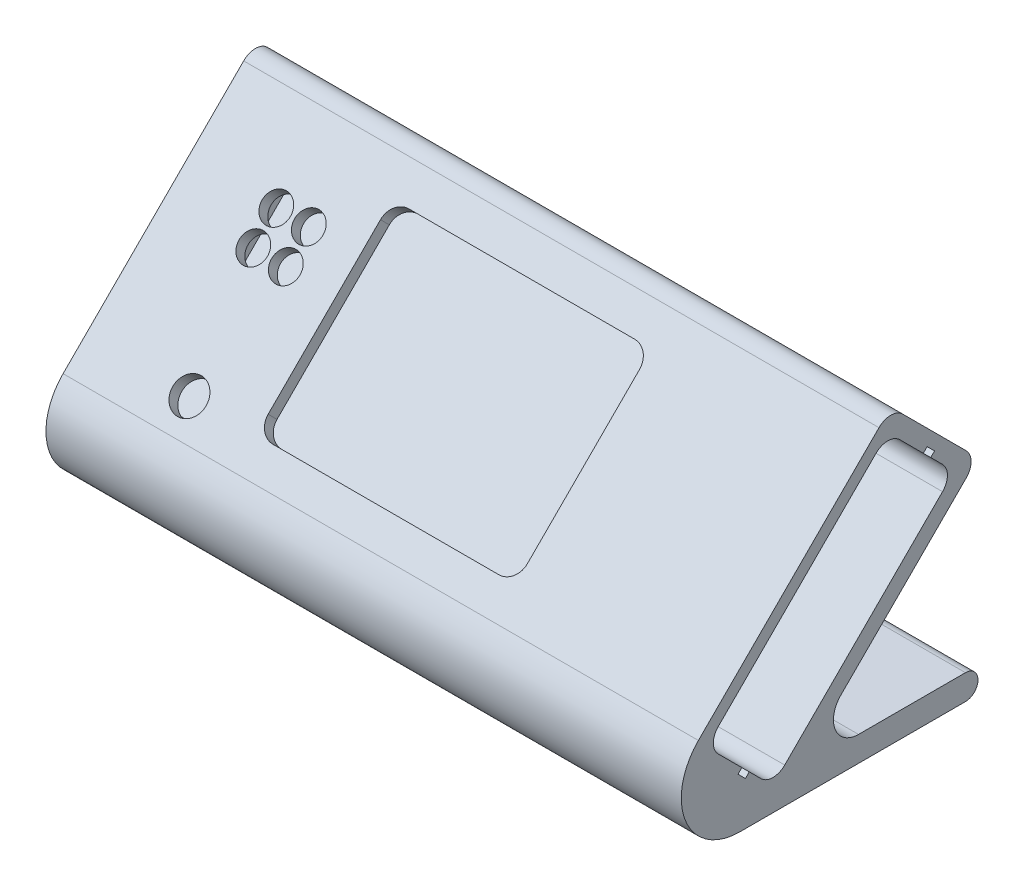
from build123d import *

# Parameters (mm, degrees)
BOSS_EXTRUDE1_DEPTH = 74.5
FILLET1_R           = 7
FILLET2_R           = 2
FILLET3_R           = 1.5
FILLET4_R           = 3
SKETCH3_R           = 2
SKETCH3_R_2         = 1.7
SKETCH3_W           = 31
SKETCH3_H           = 23
CUT_EXTRUDE1_DEPTH  = 1.5
FILLET5_R           = 2
BOSS_EXTRUDE3_DEPTH = 1.5


with BuildPart() as part:
    # Sketch1 → Boss-Extrude1 (new body)
    with BuildSketch(Plane(origin=(0, 0, 0), x_dir=(0, 0, -1), z_dir=(1, 0, 0))):
        Polygon((-20.859650045, -2.828427125), (0, -2.828427125), (24.536605307, -2.828427125), (24.536605307, 0.171572875), (3, 0.171572875), (24.536605307, 21.708178182), (14.106780285, 32.138003205), (-10.429825023, 7.601397898), align=None)
        Polygon((19.339370465, 24.996224715), (18.879751058, 24.536605307), (21.708178182, 21.708178182), (0, 0), (-2.828427125, 2.828427125), (-3.288046533, 2.368807717), (-4.171930009, 3.252691193), (-3.712310601, 3.712310601), (-7.954951288, 7.954951288), (13.753226894, 29.663129471), (17.995867581, 25.420488784), (18.455486989, 25.880108191), align=None, mode=Mode.SUBTRACT)
    extrude(amount=BOSS_EXTRUDE1_DEPTH)

    # Fillet1
    fillet1_edges = [part.edges().sort_by_distance(p)[0] for p in [
        (37.25, -2.828427125, 20.859650045),
    ]]
    fillet(fillet1_edges, radius=FILLET1_R)

    # Fillet2
    fillet2_edges = [part.edges().sort_by_distance(p)[0] for p in [
        (37.25, 32.138003205, -14.106780285),
        (37.25, 21.708178182, -24.536605307),
        (37.25, 29.663129471, -13.753226894),
        (37.25, 7.954951288, 7.954951288),
        (37.25, 0, 0),
        (37.25, 21.708178182, -21.708178182),
    ]]
    fillet(fillet2_edges, radius=FILLET2_R)

    # Fillet3
    fillet3_edges = [part.edges().sort_by_distance(p)[0] for p in [
        (37.25, -2.828427125, -24.536605307),
        (37.25, 0.171572875, -24.536605307),
    ]]
    fillet(fillet3_edges, radius=FILLET3_R - 0.0001)  # a hair under: the kernel refuses the full size

    # Fillet4
    fillet4_edges = [part.edges().sort_by_distance(p)[0] for p in [
        (37.25, 0.171572875, -3),
    ]]
    fillet(fillet4_edges, radius=FILLET4_R)

    # Sketch3 → Cut-Extrude1 (cut)
    with BuildSketch(Plane(origin=(0, 9.01561146, 9.01561146), x_dir=(1, 0, 0), z_dir=(0, 0.7071067811865475, 0.7071067811865476))):
        with Locations(Location((11, 3.85, 0), (0, 0, 270))):
            Circle(SKETCH3_R)
        with Locations(Location((12.944543648, 17.405456352, 0), (0, 0, 270))):
            Circle(SKETCH3_R_2)
        with Locations(Location((12.944543648, 21.294543648, 0), (0, 0, 270))):
            Circle(SKETCH3_R_2)
        with Locations(Location((9.055456352, 21.294543648, 0), (0, 0, 270))):
            Circle(SKETCH3_R_2)
        with Locations(Location((9.055456352, 17.405456352, 0), (0, 0, 270))):
            Circle(SKETCH3_R_2)
        with Locations((34.5, 15.35)):
            Rectangle(SKETCH3_W, SKETCH3_H)
    extrude(amount=-CUT_EXTRUDE1_DEPTH, mode=Mode.SUBTRACT)

    # Fillet5
    fillet5_edges = [part.edges().sort_by_distance(p)[0] for p in [
        (19, 11.207642482, 5.762920267),
        (19, 27.471098449, -10.500535701),
        (50, 27.471098449, -10.500535701),
        (50, 11.207642482, 5.762920267),
    ]]
    fillet(fillet5_edges, radius=FILLET5_R)

    # Sketch4 → Boss-Extrude3 (add)
    with BuildSketch(Plane.ZY):
        with BuildLine():
            Line((-23.036605307, -2.828427125), (3.960155108, -2.828427125))
            ThreePointArc((3.960155108, -2.828427125), (10.427311836, 1.492788849), (8.909902577, 9.121320344))
            Line((8.909902577, 9.121320344), (-12.692566722, 30.723789643))
            ThreePointArc((-12.692566722, 30.723789643), (-14.106780285, 31.30957608), (-15.520993847, 30.723789643))
            Line((-15.520993847, 30.723789643), (-23.122391745, 23.122391745))
            ThreePointArc((-23.122391745, 23.122391745), (-23.708178182, 21.708178182), (-23.122391745, 20.29396462))
            Line((-23.122391745, 20.29396462), (-8.121320344, 5.292893219))
            ThreePointArc((-8.121320344, 5.292893219), (-7.47100209, 2.023522578), (-10.242640687, 0.171572875))
            Line((-10.242640687, 0.171572875), (-23.036605307, 0.171572875))
            ThreePointArc((-23.036605307, 0.171572875), (-24.097265479, -0.267766953), (-24.536605307, -1.328427125))
            ThreePointArc((-24.536605307, -1.328427125), (-24.097265479, -2.389087297), (-23.036605307, -2.828427125))
        make_face()
    extrude(amount=BOSS_EXTRUDE3_DEPTH)


solid = part.part
